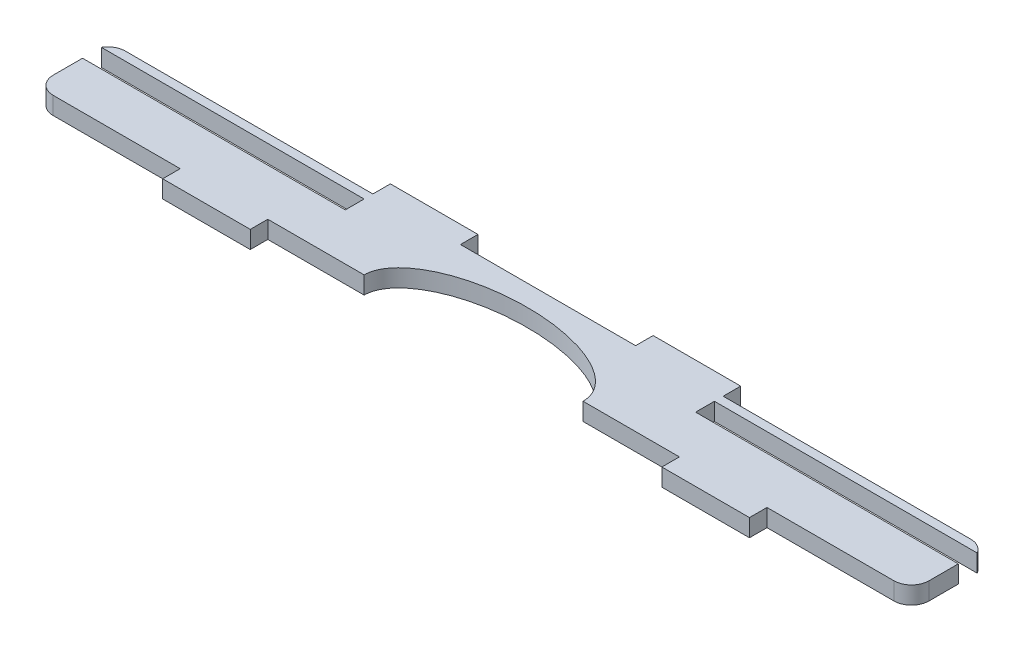
from build123d import *

# Parameters (mm, degrees)
SKETCH1_W            = 254
SKETCH1_H            = 21.59
WALL_BASE_DEPTH      = 5.08
SKETCH2_W            = 25.4
SKETCH2_H            = 5.08
TAB_DEPTH            = 5.08
SKETCH7_W            = 25.4
SKETCH7_H            = 5.08
BOSS_EXTRUDE1_DEPTH  = 5.08
SKETCH3_RX           = 31.75
SKETCH3_RY           = 15.515530829
WHEEL_WELL_CUT_DEPTH = 129.089117512
SKETCH6_W            = 76.2
SKETCH6_H            = 5.461
CUT_EXTRUDE5_DEPTH   = 129.089117627
FILLET2_R            = 5.08


with BuildPart() as part:
    # Sketch1 → Wall-Base (new body)
    with BuildSketch(Plane(origin=(0, 0, 0), x_dir=(1, 0, 0), z_dir=(0, 1, 0))):
        Rectangle(SKETCH1_W, SKETCH1_H)
    extrude(amount=WALL_BASE_DEPTH)

    # Sketch2 → Tab (add)
    with BuildSketch(Plane(origin=(0, 0, -10.795), x_dir=(-1, 0, 0), z_dir=(0, 0, -1))):
        with Locations((38.1, 2.54)):
            Rectangle(SKETCH2_W, SKETCH2_H)
    tab = extrude(amount=TAB_DEPTH)

    # Sketch7 → Boss-Extrude1 (add)
    with BuildSketch(Plane.XY.offset(10.795)):
        with Locations((-72.39, 2.54)):
            Rectangle(SKETCH7_W, SKETCH7_H)
    boss_extrude1 = extrude(amount=BOSS_EXTRUDE1_DEPTH)

    # Mirror1: Tab across plane
    add(tab.mirror(Plane.ZY))

    # Sketch3 → Wheel-Well-Cut (cut, through all)
    with BuildSketch(Plane(origin=(0, 5.08, 0), x_dir=(1, 0, 0), z_dir=(0, 1, 0))):
        with Locations(Location((0, -10.795), (0, 0, 0))):
            Ellipse(SKETCH3_RX, SKETCH3_RY)
    extrude(amount=-WHEEL_WELL_CUT_DEPTH, mode=Mode.SUBTRACT)

    # Sketch6 → Cut-Extrude5 (cut, through all)
    with BuildSketch(Plane(origin=(0, 5.08, 0), x_dir=(1, 0, 0), z_dir=(0, 1, 0))):
        with Locations((-88.9, 5.5245)):
            Rectangle(SKETCH6_W, SKETCH6_H)
    cut_extrude5 = extrude(amount=-CUT_EXTRUDE5_DEPTH, mode=Mode.SUBTRACT)

    # Mirror4: Cut-Extrude5 across plane
    add(cut_extrude5.mirror(Plane.ZY), mode=Mode.SUBTRACT)

    # Fillet2
    # the kernel refuses this fillet: 5.08 mm, written as the material it takes off along each edge
    with BuildSketch(Plane(origin=(127, -12.7, 10.795), x_dir=(0, 0, -1), z_dir=(0, 1, 0)), Plane(origin=(-127, -12.7, 10.795), x_dir=(1, 0, 0), z_dir=(0, 1, 0))) as fillet2_piece_1:
        with BuildLine():
            CenterArc((FILLET2_R, FILLET2_R), FILLET2_R, 180, 90)
            Line((0, FILLET2_R), (-FILLET2_R * 0.02, FILLET2_R))
            Line((-FILLET2_R * 0.02, FILLET2_R), (-FILLET2_R * 0.02, -FILLET2_R * 0.02))
            Line((-FILLET2_R * 0.02, -FILLET2_R * 0.02), (FILLET2_R, -FILLET2_R * 0.02))
            Line((FILLET2_R, -FILLET2_R * 0.02), (FILLET2_R, 0))
        make_face()
    extrude(amount=30.48, mode=Mode.SUBTRACT)
    with BuildSketch(Plane(origin=(-127, -10.998522628, -10.795), x_dir=(0, 0, 1), z_dir=(0, 1, 0))) as fillet2_piece_2:
        with BuildLine():
            CenterArc((5.08, 4.399409051), FILLET2_R, 180, 60)
            Line((0, 4.399409051), (-0.1016, 4.399409051))
            Line((-0.1016, 4.399409051), (-0.1016, 0))
            Line((-0.1016, 0), (0, -0.1016))
            ThreePointArc((0, -0.1016), (1.27, -0.1016), (2.4892, -0.087988181))
            Line((2.4892, -0.087988181), (2.54, 0))
        make_face()
    extrude(amount=27.077045256, mode=Mode.SUBTRACT)
    with BuildSketch(Plane(origin=(127, -10.998522628, -10.795), x_dir=(-1, 0, 0), z_dir=(0, 1, 0))) as fillet2_piece_3:
        with BuildLine():
            CenterArc((4.399409051, 5.08), FILLET2_R, 210, 60)
            Line((0, 2.54), (-0.087988181, 2.4892))
            ThreePointArc((-0.087988181, 2.4892), (-0.1016, 1.27), (-0.1016, 0))
            Line((-0.1016, 0), (0, -0.1016))
            Line((0, -0.1016), (4.399409051, -0.1016))
            Line((4.399409051, -0.1016), (4.399409051, 0))
        make_face()
    extrude(amount=27.077045256, mode=Mode.SUBTRACT)

    # Mirror5: Boss-Extrude1 across plane
    add(boss_extrude1.mirror(Plane.ZY))


solid = part.part
